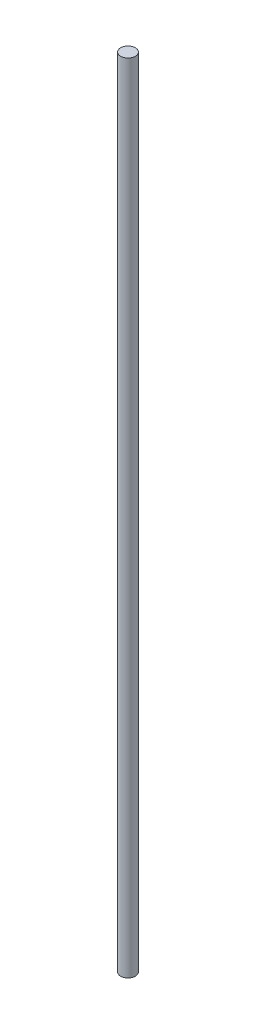
from build123d import *

# Parameters (mm, degrees)
SKETCH1_R           = 1.5875
BOSS_EXTRUDE1_DEPTH = 171.45


with BuildPart() as part:
    # Sketch1 → Boss-Extrude1 (new body)
    with BuildSketch(Plane(origin=(0, 0, 0), x_dir=(1, 0, 0), z_dir=(0, 1, 0))):
        Circle(SKETCH1_R)
    extrude(amount=BOSS_EXTRUDE1_DEPTH)


solid = part.part
